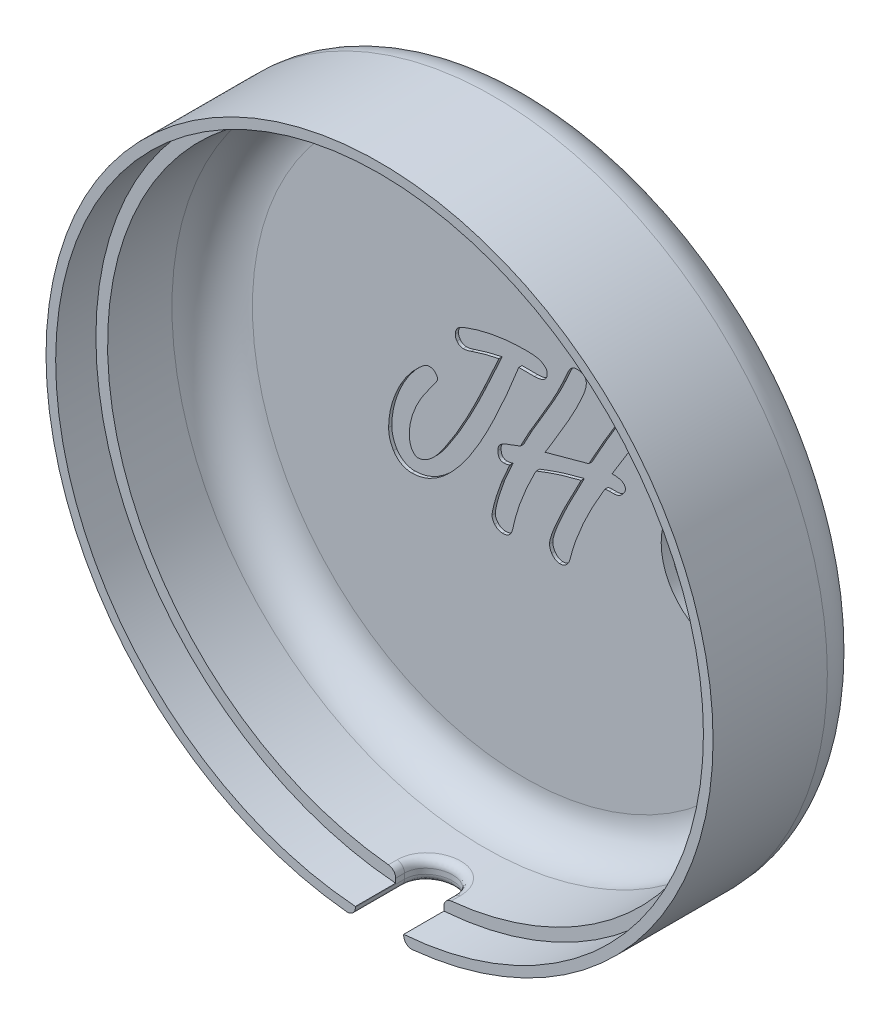
from build123d import *

# Parameters (mm, degrees)
SKETCH1_R           = 41.45
BOSS_EXTRUDE1_DEPTH = 19.2
SKETCH2_R           = 38.8
CUT_EXTRUDE1_DEPTH  = 18
SKETCH3_R           = 40.25
CUT_EXTRUDE2_DEPTH  = 5
CUT_EXTRUDE3_REACH  = 63.683
SKETCH4_R           = 8
FILLET1_R           = 5
SKETCH7_R           = 3
SKETCH7_W           = 6
SKETCH7_H           = 8.189417119
CUT_EXTRUDE4_DEPTH  = 5
FILLET2_R           = 1
CUT_EXTRUDE5_START  = -0.4
CUT_EXTRUDE5_DEPTH  = 0.4


# Read off the part's stored shape, not the designer's step: Cut-Extrude5
with BuildPart() as part:
    # Sketch1 → Boss-Extrude1 (new body)
    with BuildSketch(Plane.XY):
        Circle(SKETCH1_R)
    extrude(amount=BOSS_EXTRUDE1_DEPTH)

    # Sketch2 → Cut-Extrude1 (cut)
    with BuildSketch(Plane.XY.offset(19.2)):
        Circle(SKETCH2_R)
    extrude(amount=-CUT_EXTRUDE1_DEPTH, mode=Mode.SUBTRACT)

    # Sketch3 → Cut-Extrude2 (cut)
    with BuildSketch(Plane.XY.offset(19.2)):
        Circle(SKETCH3_R)
    extrude(amount=-CUT_EXTRUDE2_DEPTH, mode=Mode.SUBTRACT)

    # Sketch4 → Cut-Extrude3 (cut, up to next)
    with BuildSketch(Plane(origin=(0, 0, 0), x_dir=(-1, 0, 0), z_dir=(0, 0, -1)), mode=Mode.PRIVATE) as cut_extrude3_sk1:
        with Locations((-25, 0)):
            Circle(SKETCH4_R)
    cut_extrude3_tool1 = extrude(cut_extrude3_sk1.sketch, amount=-CUT_EXTRUDE3_REACH, mode=Mode.PRIVATE) & part.part
    add(cut_extrude3_tool1.solids().sort_by_distance((25, 0, 0))[0], mode=Mode.SUBTRACT)

    # Fillet1
    fillet1_edges = [part.edges().sort_by_distance(p)[0] for p in [
        (-41.45, 0, 0),
        (-38.8, 0, 1.2),
    ]]
    fillet(fillet1_edges, radius=FILLET1_R)

    # Sketch7 → Cut-Extrude4 (cut)
    with BuildSketch(Plane(origin=(0, -41.45, 0), x_dir=(-1, 0, 0), z_dir=(0, -1, 0))):
        with Locations((0, -13.1)):
            Circle(SKETCH7_R)
        with Locations((0, -17.19470856)):
            Rectangle(SKETCH7_W, SKETCH7_H)
    extrude(amount=-CUT_EXTRUDE4_DEPTH, mode=Mode.SUBTRACT)

    # Fillet2
    fillet2_edges = [part.edges().sort_by_distance(p)[0] for p in [
        (-1e-09, -38.800000001, 10.1),
        (3, -38.683846758, 13.65),
        (-3, -38.683846758, 13.65),
        (3, -41.341292916, 16.15),
        (0, -41.45, 10.1),
        (-3, -41.341292916, 16.15),
    ]]
    fillet(fillet2_edges, radius=FILLET2_R)

    # Cut-Extrude5 outline → Cut-Extrude5 (cut)
    with BuildSketch(Plane.XY.offset(1.2).offset(CUT_EXTRUDE5_START)):
        with BuildLine():
            add(Edge.make_bspline(
                [(-0.697150827, 10.026777604), (-0.905931265, 9.501065299), (-1.314936129, 8.471184855), (-1.9336858, 6.964536413), (-2.556283659, 5.531327146), (-3.169974082, 4.165447293), (-3.782771264, 2.871846184), (-4.383188318, 1.645756075), (-4.986153002, 0.492921582), (-5.397979475, -0.246391681), (-5.598936542, -0.607150968)],
                knots=[0, 0, 0, 0, 0.144806581, 0.283678858, 0.416936673, 0.544813786, 0.666997033, 0.783359402, 0.894286886, 1, 1, 1, 1], degree=3))
            Line((-0.697150827, 10.026777604), (1.240349173, 10.026777604))
            add(Edge.make_bspline(
                [(2.843027744, 11.138384746), (2.837539305, 11.051613441), (2.827019747, 10.885301), (2.756349571, 10.650055134), (2.626479758, 10.45008605), (2.441505214, 10.293197072), (2.210546244, 10.169373856), (1.929097428, 10.089569596), (1.601098689, 10.034784641), (1.365621853, 10.029558101), (1.240349173, 10.026777604)],
                knots=[0, 0, 0, 0, 0.117566838, 0.225337488, 0.328797092, 0.435962496, 0.550534736, 0.681280726, 0.830442694, 1, 1, 1, 1], degree=3))
            add(Edge.make_bspline(
                [(2.075170601, 12.062491889), (2.189619246, 11.999804269), (2.399482147, 11.884854846), (2.651599263, 11.664893763), (2.812767682, 11.411849553), (2.833092948, 11.228167015), (2.843027744, 11.138384746)],
                knots=[0, 0, 0, 0, 0.308877557, 0.566384514, 0.788052894, 1, 1, 1, 1], degree=3))
            add(Edge.make_bspline(
                [(0.200170601, 12.312491889), (0.408769139, 12.311776674), (0.790941985, 12.310466331), (1.311748331, 12.256859254), (1.736359159, 12.196838737), (1.972036036, 12.103387214), (2.075170601, 12.062491889)],
                knots=[0, 0, 0, 0, 0.328399624, 0.60166011, 0.825682468, 1, 1, 1, 1], degree=3))
            add(Edge.make_bspline(
                [(-7.572150827, 10.901777604), (-7.269758889, 11.015351133), (-6.662783657, 11.243321231), (-5.729188678, 11.523167992), (-4.78359342, 11.773180759), (-3.818364504, 11.966584164), (-2.839041059, 12.126017051), (-1.840200221, 12.229097231), (-0.826161529, 12.300322733), (-0.143705747, 12.308414569), (0.200170601, 12.312491889)],
                knots=[0, 0, 0, 0, 0.121936983, 0.244757611, 0.367824779, 0.491137995, 0.61631142, 0.742339539, 0.870169847, 1, 1, 1, 1], degree=3))
            add(Edge.make_bspline(
                [(-8.585543684, 9.669634746), (-8.581316208, 9.736760048), (-8.572957632, 9.869480338), (-8.530622248, 10.063225077), (-8.446610096, 10.240472053), (-8.333422275, 10.403401822), (-8.187836868, 10.551493709), (-8.012786886, 10.686445626), (-7.803223596, 10.801688679), (-7.651606603, 10.867361418), (-7.572150827, 10.901777604)],
                knots=[0, 0, 0, 0, 0.118173097, 0.233652103, 0.346007852, 0.460654351, 0.580893769, 0.7095985, 0.847813387, 1, 1, 1, 1], degree=3))
            add(Edge.make_bspline(
                [(-8.384650827, 9.017849032), (-8.443790955, 9.116378702), (-8.564206918, 9.316996209), (-8.578347827, 9.550706864), (-8.585543684, 9.669634746)],
                knots=[0, 0, 0, 0, 0.491131963, 1, 1, 1, 1], degree=3))
            add(Edge.make_bspline(
                [(-7.603400827, 8.598206175), (-7.677141084, 8.603208897), (-7.824666971, 8.613217419), (-8.033432721, 8.699898384), (-8.227913246, 8.831554388), (-8.3308449, 8.953896558), (-8.384650827, 9.017849032)],
                knots=[0, 0, 0, 0, 0.239986405, 0.480120479, 0.728241031, 1, 1, 1, 1], degree=3))
            add(Edge.make_bspline(
                [(-6.616793684, 8.803563318), (-6.784787977, 8.744867277), (-7.104831259, 8.633046373), (-7.44282417, 8.609427322), (-7.603400827, 8.598206175)],
                knots=[0, 0, 0, 0, 0.524911168, 1, 1, 1, 1], degree=3))
            add(Edge.make_bspline(
                [(-3.156972256, 9.741063318), (-3.344484452, 9.699467981), (-3.707851882, 9.618863141), (-4.234156133, 9.50090595), (-4.721179431, 9.377417935), (-5.174057426, 9.26547822), (-5.585610028, 9.141538928), (-5.963677595, 9.032153533), (-6.303449324, 8.921230619), (-6.515854751, 8.841467979), (-6.616793684, 8.803563318)],
                knots=[0, 0, 0, 0, 0.160609661, 0.311234794, 0.450965454, 0.580739765, 0.701240385, 0.81029475, 0.909848604, 1, 1, 1, 1], degree=3))
            add(Edge.make_bspline(
                [(-5.05875797, 5.607134746), (-4.959601034, 5.824649086), (-4.767106467, 6.246912319), (-4.478079745, 6.857098588), (-4.217206905, 7.433355207), (-3.970829456, 7.968680361), (-3.743645886, 8.466622822), (-3.528503709, 8.923183703), (-3.336459128, 9.344970567), (-3.214971219, 9.613070843), (-3.156972256, 9.741063318)],
                knots=[0, 0, 0, 0, 0.157598314, 0.305947524, 0.445114185, 0.574619034, 0.694462167, 0.805946338, 0.907357766, 1, 1, 1, 1], degree=3))
            add(Edge.make_bspline(
                [(-10.040900827, -3.410722396), (-9.841045553, -3.118846029), (-9.430315617, -2.519000155), (-8.833195403, -1.566425088), (-8.222409814, -0.548003665), (-7.606417994, 0.546352233), (-6.977664468, 1.707618081), (-6.344220664, 2.944765565), (-5.696546659, 4.248411108), (-5.274291617, 5.14796909), (-5.05875797, 5.607134746)],
                knots=[0, 0, 0, 0, 0.102876461, 0.211425205, 0.32692201, 0.44824846, 0.576642762, 0.710981975, 0.852475156, 1, 1, 1, 1], degree=3))
            add(Edge.make_bspline(
                [(-13.24625797, -5.973222396), (-13.124819838, -5.964881001), (-12.871909196, -5.947508965), (-12.492827175, -5.816884789), (-12.105657394, -5.612397337), (-11.713019743, -5.324072608), (-11.303624815, -4.964104632), (-10.888510294, -4.519590337), (-10.456137583, -3.99994704), (-10.183957577, -3.613721195), (-10.040900827, -3.410722396)],
                knots=[0, 0, 0, 0, 0.085779314, 0.178646532, 0.280806708, 0.394718112, 0.522247698, 0.665935908, 0.824417216, 1, 1, 1, 1], degree=3))
            add(Edge.make_bspline(
                [(-13.991793684, -5.392865254), (-13.937291461, -5.480554446), (-13.837587185, -5.640969686), (-13.649190592, -5.824410848), (-13.454807968, -5.950984737), (-13.313268336, -5.96607709), (-13.24625797, -5.973222396)],
                knots=[0, 0, 0, 0, 0.312786899, 0.572200343, 0.797463005, 1, 1, 1, 1], degree=3))
            add(Edge.make_bspline(
                [(-14.299829399, -3.982150968), (-14.297341069, -4.12231755), (-14.29263082, -4.38764386), (-14.232274187, -4.764994051), (-14.140194924, -5.101025933), (-14.039575761, -5.298899133), (-13.991793684, -5.392865254)],
                knots=[0, 0, 0, 0, 0.287775205, 0.544739923, 0.783805877, 1, 1, 1, 1], degree=3))
            add(Edge.make_bspline(
                [(-11.701615113, 2.303563318), (-11.906999319, 2.024419781), (-12.306409182, 1.481570435), (-12.838584453, 0.656004046), (-13.290123345, -0.153560828), (-13.651151086, -0.951075566), (-13.941944753, -1.729889712), (-14.148783548, -2.494548443), (-14.275297096, -3.244288547), (-14.291749636, -3.739134531), (-14.299829399, -3.982150968)],
                knots=[0, 0, 0, 0, 0.15021734, 0.292127073, 0.425533346, 0.551698569, 0.671305053, 0.785545417, 0.894682405, 1, 1, 1, 1], degree=3))
            add(Edge.make_bspline(
                [(-10.77750797, 3.736599032), (-10.780785919, 3.710956991), (-10.788826197, 3.648061217), (-10.841928775, 3.545870029), (-10.911588239, 3.410563572), (-11.015716825, 3.247987856), (-11.146398338, 3.055454908), (-11.302709334, 2.831105555), (-11.490758875, 2.576956889), (-11.628360449, 2.398544402), (-11.701615113, 2.303563318)],
                knots=[0, 0, 0, 0, 0.044929954, 0.110205898, 0.198698458, 0.312088769, 0.44707951, 0.605930886, 0.790210245, 1, 1, 1, 1], degree=3))
            add(Edge.make_bspline(
                [(-11.02750797, 4.254456175), (-10.988622433, 4.206435098), (-10.917349681, 4.118417942), (-10.841509825, 3.980221547), (-10.785302293, 3.856948164), (-10.779947693, 3.774269854), (-10.77750797, 3.736599032)],
                knots=[0, 0, 0, 0, 0.315684952, 0.578614502, 0.808003593, 1, 1, 1, 1], degree=3))
            add(Edge.make_bspline(
                [(-11.853400827, 4.584813318), (-11.766777309, 4.58019908), (-11.603280704, 4.571489987), (-11.371368789, 4.515135891), (-11.175300917, 4.408047225), (-11.075890169, 4.304736468), (-11.02750797, 4.254456175)],
                knots=[0, 0, 0, 0, 0.282855468, 0.533872437, 0.773140463, 1, 1, 1, 1], degree=3))
            add(Edge.make_bspline(
                [(-13.040900827, 3.870527604), (-12.922406287, 3.977385775), (-12.707794448, 4.170922359), (-12.389724485, 4.397312909), (-12.112786201, 4.548883726), (-11.931985344, 4.573927933), (-11.853400827, 4.584813318)],
                knots=[0, 0, 0, 0, 0.339080621, 0.614127159, 0.832281597, 1, 1, 1, 1], degree=3))
            add(Edge.make_bspline(
                [(-15.420365113, 0.790170461), (-15.26029888, 1.074635016), (-14.9409714, 1.642133529), (-14.371041387, 2.434945958), (-13.748276144, 3.189885276), (-13.277657583, 3.642718312), (-13.040900827, 3.870527604)],
                knots=[0, 0, 0, 0, 0.250266892, 0.49927517, 0.748097512, 1, 1, 1, 1], degree=3))
            add(Edge.make_bspline(
                [(-16.87125797, -4.526793825), (-16.866801449, -4.312358644), (-16.857836229, -3.8809776), (-16.789368064, -3.230179473), (-16.670340996, -2.575213958), (-16.516538728, -1.911845478), (-16.307647542, -1.245215847), (-16.056786988, -0.570481491), (-15.763745411, 0.113034363), (-15.535970507, 0.56219994), (-15.420365113, 0.790170461)],
                knots=[0, 0, 0, 0, 0.115586236, 0.232525795, 0.35227932, 0.474279484, 0.599373629, 0.728567483, 0.862236522, 1, 1, 1, 1], degree=3))
            add(Edge.make_bspline(
                [(-16.264115113, -6.700900968), (-16.35651834, -6.534964191), (-16.539958499, -6.205544218), (-16.733919408, -5.670754218), (-16.846663176, -5.107437572), (-16.862979144, -4.722243669), (-16.87125797, -4.526793825)],
                knots=[0, 0, 0, 0, 0.249048342, 0.494414196, 0.743462538, 1, 1, 1, 1], degree=3))
            add(Edge.make_bspline(
                [(-13.978400827, -7.973222396), (-14.097805675, -7.970888539), (-14.330944069, -7.966331673), (-14.668859279, -7.898555865), (-14.988317889, -7.803311759), (-15.286472174, -7.661664609), (-15.565356433, -7.482989356), (-15.821089836, -7.259821145), (-16.060546583, -7.001056569), (-16.195185311, -6.802535863), (-16.264115113, -6.700900968)],
                knots=[0, 0, 0, 0, 0.130544888, 0.254889364, 0.376031111, 0.494870668, 0.61512113, 0.737625595, 0.865674489, 1, 1, 1, 1], degree=3))
            add(Edge.make_bspline(
                [(-10.241793684, -6.491079539), (-10.396310889, -6.609587509), (-10.697966626, -6.840944329), (-11.169840334, -7.139652897), (-11.639133661, -7.395858237), (-12.107103119, -7.606860359), (-12.576278372, -7.769980652), (-13.044162266, -7.884580091), (-13.511587813, -7.961452857), (-13.823344244, -7.969313027), (-13.978400827, -7.973222396)],
                knots=[0, 0, 0, 0, 0.142572296, 0.278336326, 0.408561719, 0.533953305, 0.653911731, 0.7718173, 0.886510025, 1, 1, 1, 1], degree=3))
            add(Edge.make_bspline(
                [(-5.598936542, -0.607150968), (-5.786972582, -0.930057042), (-6.153875682, -1.5601237), (-6.731049182, -2.456628946), (-7.307737134, -3.288620624), (-7.882601486, -4.06061171), (-8.466431963, -4.764368584), (-9.051338878, -5.404045083), (-9.635800995, -5.981299137), (-10.043114643, -6.323944385), (-10.241793684, -6.491079539)],
                knots=[0, 0, 0, 0, 0.148741709, 0.290230501, 0.424326713, 0.551695533, 0.673284627, 0.788173067, 0.896675272, 1, 1, 1, 1], degree=3))
        make_face()
        with BuildLine():
            add(Edge.make_bspline(
                [(3.12874203, -7.049115254), (3.131195682, -6.978929569), (3.136622652, -6.823693428), (3.19474035, -6.571431314), (3.268813044, -6.271476749), (3.376725951, -5.9258556), (3.517552464, -5.535147822), (3.686835438, -5.100923296), (3.884799163, -4.618059147), (4.116521999, -4.092286581), (4.375528928, -3.518670187), (4.667523617, -2.901900425), (4.987896858, -2.23766276), (5.341051879, -1.528024487), (5.725226242, -0.773651799), (6.140282784, 0.025556039), (6.58857601, 0.86903389), (6.895182423, 1.447871124), (7.052849173, 1.745527604)],
                knots=[0, 0, 0, 0, 0.021747749, 0.048101499, 0.080021038, 0.117706224, 0.160355146, 0.208892419, 0.262317198, 0.322286185, 0.387178774, 0.45761927, 0.534036258, 0.616022395, 0.70358633, 0.796735156, 0.895474765, 1, 1, 1, 1], degree=3))
            add(Edge.make_bspline(
                [(3.401063458, -7.937508111), (3.358553787, -7.868766735), (3.274827371, -7.733374744), (3.191088533, -7.512408741), (3.139370202, -7.283656892), (3.13232873, -7.128266262), (3.12874203, -7.049115254)],
                knots=[0, 0, 0, 0, 0.25676063, 0.505711916, 0.748225488, 1, 1, 1, 1], degree=3))
            add(Edge.make_bspline(
                [(4.37874203, -8.544650968), (4.289894954, -8.535924539), (4.108391357, -8.518097524), (3.845781441, -8.399163627), (3.606443924, -8.198793716), (3.472314364, -8.028153714), (3.401063458, -7.937508111)],
                knots=[0, 0, 0, 0, 0.223103429, 0.455772735, 0.710901267, 1, 1, 1, 1], degree=3))
            add(Edge.make_bspline(
                [(5.682313458, -7.383936682), (5.656272126, -7.475443005), (5.606516728, -7.650277899), (5.500278752, -7.889102447), (5.367518856, -8.089597086), (5.217300962, -8.258693871), (5.036830313, -8.384874567), (4.839110269, -8.481786748), (4.615090467, -8.535062763), (4.459361087, -8.541380407), (4.37874203, -8.544650968)],
                knots=[0, 0, 0, 0, 0.149844548, 0.286297766, 0.409890343, 0.527741849, 0.640342243, 0.754687732, 0.873005057, 1, 1, 1, 1], degree=3))
            add(Edge.make_bspline(
                [(9.999277744, 2.272313318), (9.736618748, 1.830162656), (9.222891644, 0.965373014), (8.506294725, -0.326469609), (7.861534952, -1.585441565), (7.291914896, -2.812582542), (6.783654798, -4.002391491), (6.345620705, -5.157532504), (5.975538049, -6.278835246), (5.778529749, -7.021317841), (5.682313458, -7.383936682)],
                knots=[0, 0, 0, 0, 0.145329698, 0.284246137, 0.417402929, 0.544962964, 0.666499742, 0.782953815, 0.893997467, 1, 1, 1, 1], degree=3))
            add(Edge.make_bspline(
                [(10.53499203, 2.330349032), (10.449950342, 2.327974745), (10.269870021, 2.322947064), (10.092752656, 2.289804523), (9.999277744, 2.272313318)],
                knots=[0, 0, 0, 0, 0.472243097, 1, 1, 1, 1], degree=3))
            Line((10.53499203, 2.330349032), (11.070706316, 2.330349032))
            add(Edge.make_bspline(
                [(12.03499203, 2.660706175), (11.974515329, 2.609981269), (11.851002238, 2.506384514), (11.619824056, 2.405836419), (11.356910957, 2.342154702), (11.169348481, 2.334417928), (11.070706316, 2.330349032)],
                knots=[0, 0, 0, 0, 0.225944197, 0.461451535, 0.716768578, 1, 1, 1, 1], degree=3))
            add(Edge.make_bspline(
                [(12.557313458, 3.535706175), (12.550711706, 3.469194294), (12.53642047, 3.325211772), (12.424123186, 3.111239719), (12.257791505, 2.884042354), (12.113214249, 2.739116825), (12.03499203, 2.660706175)],
                knots=[0, 0, 0, 0, 0.190617272, 0.4126414, 0.682214932, 1, 1, 1, 1], degree=3))
            add(Edge.make_bspline(
                [(10.905527744, 4.379456175), (11.035064606, 4.377158569), (11.277005517, 4.372867242), (11.614251794, 4.335159929), (11.899153451, 4.266235417), (12.140185429, 4.18487454), (12.323926205, 4.059551624), (12.463594888, 3.913763551), (12.541647712, 3.731347693), (12.552017479, 3.601844969), (12.557313458, 3.535706175)],
                knots=[0, 0, 0, 0, 0.188262417, 0.351624858, 0.491680479, 0.61419038, 0.718559272, 0.811954729, 0.903962735, 1, 1, 1, 1], degree=3))
            add(Edge.make_bspline(
                [(10.901783557, 4.379318822), (10.903033417, 4.379364821), (10.904280581, 4.379410498), (10.905527744, 4.379456175)],
                knots=[0.9786483, 0.9786483, 0.9786483, 0.9786483, 1, 1, 1, 1], degree=3))
            add(Edge.make_bspline(
                [(13.052849173, 7.879456175), (12.915388994, 7.655092025), (12.654470533, 7.229217788), (12.291431377, 6.617499379), (11.953644189, 6.081874906), (11.665385668, 5.604156245), (11.407158173, 5.197591149), (11.203830531, 4.845554254), (11.030220121, 4.586057074), (10.936925073, 4.436121998), (10.901783557, 4.379318822)],
                knots=[0, 0, 0, 0, 0.189718448, 0.360111895, 0.512855968, 0.646269272, 0.762391248, 0.860100611, 0.939266739, 0.987425917, 0.987425917, 0.987425917, 0.987425917], degree=3))
            add(Edge.make_bspline(
                [(14.22249203, 9.816956175), (14.210571007, 9.796133017), (14.176458351, 9.736546419), (14.110913502, 9.620212768), (14.004889015, 9.457356529), (13.87889472, 9.237102796), (13.716714446, 8.970125001), (13.524601867, 8.650853943), (13.296764419, 8.283718951), (13.137361346, 8.019525836), (13.052849173, 7.879456175)],
                knots=[0, 0, 0, 0, 0.031805556, 0.091013328, 0.176947208, 0.289258345, 0.427276757, 0.591005878, 0.783159876, 1, 1, 1, 1], degree=3))
            add(Edge.make_bspline(
                [(14.843027744, 11.499991889), (14.833147174, 11.395137138), (14.810688526, 11.156801089), (14.680729074, 10.77203282), (14.487736399, 10.313766618), (14.316291648, 9.992645596), (14.22249203, 9.816956175)],
                knots=[0, 0, 0, 0, 0.174332224, 0.396259139, 0.669685647, 1, 1, 1, 1], degree=3))
            add(Edge.make_bspline(
                [(14.561777744, 12.191956175), (14.605789047, 12.12927219), (14.688558823, 12.011385669), (14.769785653, 11.826567217), (14.83121449, 11.660073397), (14.839261006, 11.551034996), (14.843027744, 11.499991889)],
                knots=[0, 0, 0, 0, 0.302492748, 0.568882434, 0.798185046, 1, 1, 1, 1], degree=3))
            add(Edge.make_bspline(
                [(13.56624203, 12.598206175), (13.67398337, 12.593546761), (13.876156738, 12.584803512), (14.154793007, 12.50820554), (14.392145128, 12.382994397), (14.505478254, 12.255359988), (14.561777744, 12.191956175)],
                knots=[0, 0, 0, 0, 0.289636785, 0.543494667, 0.773225898, 1, 1, 1, 1], degree=3))
            add(Edge.make_bspline(
                [(12.584099173, 11.790170461), (12.652119953, 11.911317682), (12.777592186, 12.13478781), (13.020070377, 12.393019867), (13.281607258, 12.569962948), (13.473131082, 12.588967129), (13.56624203, 12.598206175)],
                knots=[0, 0, 0, 0, 0.310934712, 0.573555209, 0.792680211, 1, 1, 1, 1], degree=3))
            add(Edge.make_bspline(
                [(12.09749203, 10.959813318), (12.160791975, 11.060538019), (12.273804809, 11.240367302), (12.412599985, 11.48312362), (12.521542507, 11.65378885), (12.566878871, 11.75262798), (12.584099173, 11.790170461)],
                knots=[0, 0, 0, 0, 0.370533912, 0.661534334, 0.871439167, 1, 1, 1, 1], degree=3))
            add(Edge.make_bspline(
                [(8.012670601, 4.017849032), (8.151876069, 4.278632777), (8.435990811, 4.81088562), (8.883654144, 5.618308683), (9.353965855, 6.451901246), (9.857682749, 7.304582528), (10.37904049, 8.185518891), (10.927416175, 9.090795293), (11.503661829, 10.018274522), (11.897725538, 10.643076476), (12.09749203, 10.959813318)],
                knots=[0, 0, 0, 0, 0.11007347, 0.224657091, 0.343765686, 0.466455191, 0.593416091, 0.724938371, 0.860560373, 1, 1, 1, 1], degree=3))
            add(Edge.make_bspline(
                [(2.573378767, 2.531954934), (3.054598337, 2.668729554), (4.002597638, 2.938159483), (5.394171121, 3.331749945), (6.727036521, 3.686924706), (7.592879257, 3.90979405), (8.012670601, 4.017849032)],
                knots=[0.006215282, 0.006215282, 0.006215282, 0.006215282, 0.270722875, 0.527291138, 0.770813936, 1, 1, 1, 1], degree=3))
            add(Edge.make_bspline(
                [(3.37874203, 3.843741889), (3.281575903, 3.687761587), (3.099665774, 3.39574216), (2.852151578, 2.984081949), (2.67777267, 2.704686217), (2.59028369, 2.560028412), (2.573378767, 2.531954934)],
                knots=[0, 0, 0, 0, 0.309825102, 0.580040861, 0.809820155, 0.865070605, 0.865070605, 0.865070605, 0.865070605], degree=3))
            add(Edge.make_bspline(
                [(7.700170601, 12.482134746), (7.695791316, 12.409031196), (7.686153477, 12.248146442), (7.632163654, 11.985354152), (7.54691921, 11.68180634), (7.429312875, 11.332418233), (7.270333659, 10.945088141), (7.089424265, 10.509735164), (6.868062418, 10.03592944), (6.612537705, 9.519263354), (6.328387313, 8.956594947), (6.005463902, 8.353076498), (5.646216595, 7.70854803), (5.266278608, 7.013273159), (4.837792751, 6.283787043), (4.385472957, 5.505815564), (3.891834013, 4.689742821), (3.552905361, 4.130907437), (3.37874203, 3.843741889)],
                knots=[0, 0, 0, 0, 0.022606857, 0.049752695, 0.082662223, 0.120033528, 0.163582096, 0.212006873, 0.265705266, 0.325137916, 0.390122844, 0.460477573, 0.536628497, 0.618138679, 0.705290421, 0.798035811, 0.896217816, 1, 1, 1, 1], degree=3))
            add(Edge.make_bspline(
                [(6.494813458, 13.455349032), (6.588852304, 13.454026854), (6.766519641, 13.451528866), (7.014316292, 13.400223827), (7.226326122, 13.326560856), (7.404947291, 13.223982559), (7.537984267, 13.079117885), (7.63189959, 12.905583398), (7.692993935, 12.703370184), (7.697693205, 12.558505545), (7.700170601, 12.482134746)],
                knots=[0, 0, 0, 0, 0.159085373, 0.300559564, 0.426624433, 0.538661416, 0.645733253, 0.755243192, 0.870967319, 1, 1, 1, 1], degree=3))
            add(Edge.make_bspline(
                [(5.610884887, 12.946420461), (5.669943627, 13.024149102), (5.783268244, 13.173298382), (6.001220082, 13.335223671), (6.24056826, 13.439172166), (6.408931553, 13.449884622), (6.494813458, 13.455349032)],
                knots=[0, 0, 0, 0, 0.274503117, 0.526729163, 0.758585135, 1, 1, 1, 1], degree=3))
            add(Edge.make_bspline(
                [(4.762670601, 11.138384746), (4.817640317, 11.261938353), (4.921622145, 11.495654857), (5.070021719, 11.825510548), (5.195815886, 12.116590022), (5.316534833, 12.360050653), (5.405636049, 12.569811044), (5.492899229, 12.730065262), (5.553056492, 12.855067038), (5.594082869, 12.919877759), (5.610884887, 12.946420461)],
                knots=[0, 0, 0, 0, 0.203033607, 0.384062484, 0.543086634, 0.679008721, 0.791987234, 0.884916722, 0.952868583, 1, 1, 1, 1], degree=3))
            add(Edge.make_bspline(
                [(1.606420601, 5.401777604), (1.800131133, 5.726028225), (2.172767274, 6.349781098), (2.704009042, 7.248373202), (3.17873022, 8.075857195), (3.597438419, 8.831692945), (3.970216057, 9.510592805), (4.280186966, 10.120633148), (4.549651532, 10.649258436), (4.695629859, 10.984448335), (4.762670601, 11.138384746)],
                knots=[0, 0, 0, 0, 0.172958498, 0.33271597, 0.478006583, 0.609782621, 0.728393642, 0.832622713, 0.923131756, 1, 1, 1, 1], degree=3))
            add(Edge.make_bspline(
                [(0.593027744, 3.696420461), (0.608905404, 3.729425276), (0.646482478, 3.80753656), (0.725131575, 3.933881499), (0.818285188, 4.097250139), (0.934904912, 4.293383002), (1.072911183, 4.523367977), (1.227652639, 4.789483188), (1.413813298, 5.081895219), (1.539938288, 5.291363717), (1.606420601, 5.401777604)],
                knots=[0, 0, 0, 0, 0.055342829, 0.130977844, 0.22475209, 0.339744786, 0.475958446, 0.630309511, 0.805130777, 1, 1, 1, 1], degree=3))
            add(Edge.make_bspline(
                [(-0.491793684, 1.660706175), (-0.464635451, 1.706629005), (-0.403918955, 1.809296702), (-0.312772506, 1.984194271), (-0.199213546, 2.189970869), (-0.071911483, 2.428437438), (0.072591421, 2.699184183), (0.232770923, 3.000772035), (0.407153677, 3.337718797), (0.529028729, 3.57291451), (0.593027744, 3.696420461)],
                knots=[0, 0, 0, 0, 0.069370825, 0.155089371, 0.256405786, 0.375022502, 0.506615932, 0.655513001, 0.81910302, 1, 1, 1, 1], degree=3))
            add(Edge.make_bspline(
                [(-1.656972256, 1.218741889), (-1.533686882, 1.265486724), (-1.303882888, 1.352619119), (-0.982697451, 1.464308767), (-0.718907597, 1.568530767), (-0.561693725, 1.632336866), (-0.491793684, 1.660706175)],
                knots=[0, 0, 0, 0, 0.317369482, 0.591576864, 0.818407923, 1, 1, 1, 1], degree=3))
            add(Edge.make_bspline(
                [(-2.77750797, 0.727670461), (-2.715616648, 0.765967347), (-2.575003268, 0.85297558), (-2.323099253, 0.970600543), (-2.010294066, 1.093420954), (-1.780760123, 1.174835142), (-1.656972256, 1.218741889)],
                knots=[0, 0, 0, 0, 0.177933892, 0.404255153, 0.678714256, 1, 1, 1, 1], degree=3))
            add(Edge.make_bspline(
                [(-3.295365113, -0.200900968), (-3.290594169, -0.103063876), (-3.281432449, 0.084814268), (-3.175584137, 0.344321073), (-3.01172267, 0.569895691), (-2.857321096, 0.673905699), (-2.77750797, 0.727670461)],
                knots=[0, 0, 0, 0, 0.261770272, 0.502681672, 0.742926649, 1, 1, 1, 1], degree=3))
            add(Edge.make_bspline(
                [(-2.545365113, -1.183043825), (-2.603879188, -1.181651879), (-2.71585094, -1.17898827), (-2.870494431, -1.126219762), (-3.005091742, -1.049913825), (-3.115446112, -0.93950347), (-3.195839165, -0.7952581), (-3.252252156, -0.623986144), (-3.288402767, -0.422601186), (-3.292929533, -0.278456533), (-3.295365113, -0.200900968)],
                knots=[0, 0, 0, 0, 0.124087106, 0.237451426, 0.344091433, 0.451764523, 0.565483385, 0.692891803, 0.834763557, 1, 1, 1, 1], degree=3))
            add(Edge.make_bspline(
                [(-1.889115113, -1.058043825), (-1.992275951, -1.094494124), (-2.204576179, -1.169507152), (-2.429655989, -1.178447676), (-2.545365113, -1.183043825)],
                knots=[0, 0, 0, 0, 0.485919579, 1, 1, 1, 1], degree=3))
            add(Edge.make_bspline(
                [(-1.792191481, -1.014683235), (-1.824169106, -1.029293989), (-1.85664211, -1.043668907), (-1.889115113, -1.058043825)],
                knots=[0.819587317, 0.819587317, 0.819587317, 0.819587317, 1, 1, 1, 1], degree=3))
            add(Edge.make_bspline(
                [(-1.898043684, -1.227686682), (-1.868558451, -1.162621653), (-1.835709984, -1.090134978), (-1.796290543, -1.021658184), (-1.792191481, -1.014683235)],
                knots=[0, 0, 0, 0, 0.336848078, 0.37527067, 0.37527067, 0.37527067, 0.37527067], degree=3))
            add(Edge.make_bspline(
                [(-2.844472256, -3.392865254), (-2.828128757, -3.354164002), (-2.789740776, -3.263261628), (-2.721571782, -3.103910071), (-2.632071616, -2.90077853), (-2.527408835, -2.650535746), (-2.393854762, -2.359826428), (-2.250801426, -2.020983728), (-2.077145078, -1.640969911), (-1.96004753, -1.370762897), (-1.898043684, -1.227686682)],
                knots=[0, 0, 0, 0, 0.053334815, 0.12527402, 0.220036616, 0.335139344, 0.469605882, 0.626137439, 0.802037558, 1, 1, 1, 1], degree=3))
            add(Edge.make_bspline(
                [(-4.014115113, -7.522329539), (-4.008782072, -7.428304918), (-3.995802888, -7.199474322), (-3.907680172, -6.80810948), (-3.795367198, -6.30179902), (-3.62631287, -5.714688542), (-3.447006607, -5.089107077), (-3.246696329, -4.484971355), (-3.054435084, -3.921705836), (-2.912805138, -3.56497763), (-2.844472256, -3.392865254)],
                knots=[0, 0, 0, 0, 0.065558472, 0.159551659, 0.278824213, 0.427306476, 0.585191503, 0.732484069, 0.8709303, 1, 1, 1, 1], degree=3))
            add(Edge.make_bspline(
                [(-3.697150827, -8.348222396), (-3.745807088, -8.285822232), (-3.840439849, -8.164458615), (-3.938410781, -7.95747803), (-4.005874639, -7.743841813), (-4.011383789, -7.595750298), (-4.014115113, -7.522329539)],
                knots=[0, 0, 0, 0, 0.262082558, 0.509730823, 0.756934521, 1, 1, 1, 1], degree=3))
            add(Edge.make_bspline(
                [(-2.732865113, -8.830365254), (-2.824447567, -8.824348477), (-3.004724735, -8.812504642), (-3.263438852, -8.717134213), (-3.500312972, -8.56290336), (-3.630078683, -8.421374547), (-3.697150827, -8.348222396)],
                knots=[0, 0, 0, 0, 0.246131434, 0.48450195, 0.733553964, 1, 1, 1, 1], degree=3))
            add(Edge.make_bspline(
                [(-1.460543684, -7.781258111), (-1.48093955, -7.863613518), (-1.519939309, -8.021088615), (-1.606676647, -8.240206769), (-1.730992963, -8.420418669), (-1.875996862, -8.573801045), (-2.052998245, -8.691118275), (-2.257485162, -8.769848986), (-2.486346409, -8.820954969), (-2.647740275, -8.827115809), (-2.732865113, -8.830365254)],
                knots=[0, 0, 0, 0, 0.140101535, 0.267893797, 0.386494144, 0.499460979, 0.614651368, 0.733759859, 0.859575526, 1, 1, 1, 1], degree=3))
            add(Edge.make_bspline(
                [(1.325170601, -0.285722396), (1.15773559, -0.613483695), (0.827638091, -1.259663868), (0.378144143, -2.234888497), (-0.032123978, -3.193811762), (-0.406533714, -4.137318989), (-0.730207936, -5.069431798), (-1.016006238, -5.985029564), (-1.266975695, -6.884409583), (-1.396477859, -7.484425246), (-1.460543684, -7.781258111)],
                knots=[0, 0, 0, 0, 0.137645158, 0.271366915, 0.401524682, 0.527720192, 0.650934872, 0.770462818, 0.886445999, 1, 1, 1, 1], degree=3))
            add(Edge.make_bspline(
                [(1.490349173, -0.026793825), (1.461964186, -0.085258905), (1.416834207, -0.178213952), (1.34997718, -0.256627788), (1.325170601, -0.285722396)],
                knots=[0, 0, 0, 0, 0.628960786, 1, 1, 1, 1], degree=3))
            add(Edge.make_bspline(
                [(7.052849173, 1.745527604), (6.617297105, 1.639242727), (5.721532679, 1.420655286), (4.360296263, 1.008545799), (2.940013152, 0.527079867), (1.981737987, 0.160951294), (1.490349173, -0.026793825)],
                knots=[0, 0, 0, 0, 0.230154431, 0.473339853, 0.72993675, 1, 1, 1, 1], degree=3))
        make_face()
    extrude(amount=CUT_EXTRUDE5_DEPTH, mode=Mode.SUBTRACT)


solid = part.part
